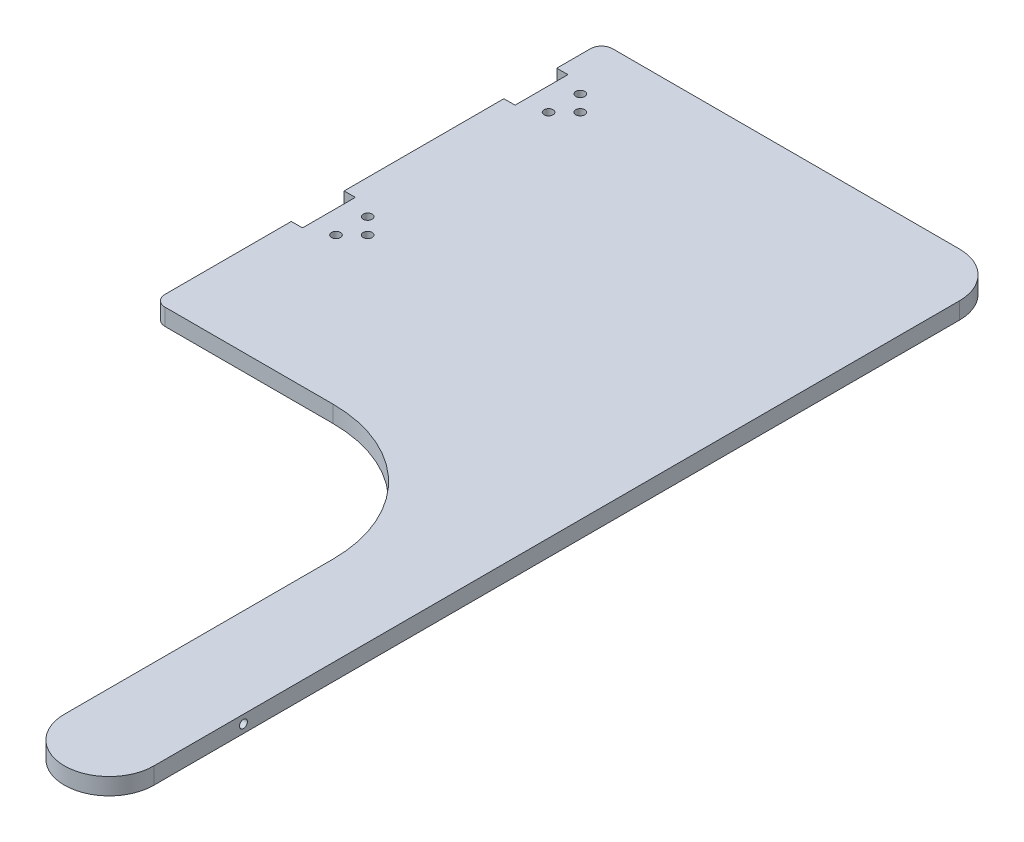
from build123d import *

# Parameters (mm, degrees)
BOSS_EXTRUDE1_DEPTH = 9.525
CUT_EXTRUDE1_REACH  = 343.855
SKETCH2_R           = 2.54
SKETCH2_W           = 6.35
SKETCH2_H           = 30
CUT_EXTRUDE2_REACH  = 343.855
SKETCH3_R           = 2.2479


with BuildPart() as part:
    # Sketch1 → Boss-Extrude1 (new body)
    with BuildSketch(Plane(origin=(0, 0, 0), x_dir=(1, 0, 0), z_dir=(0, 1, 0))):
        with BuildLine():
            Line((6.35, 0), (101.6, 0))
            ThreePointArc((101.6, 0), (155.481536726, -22.318463274), (177.8, -76.2))
            Line((177.8, -76.2), (177.8, -228.6))
            ThreePointArc((177.8, -228.6), (203.2, -254), (228.6, -228.6))
            Line((228.6, -228.6), (228.6, 228.6))
            ThreePointArc((228.6, 228.6), (221.160512242, 246.560512242), (203.2, 254))
            Line((203.2, 254), (6.35, 254))
            ThreePointArc((6.35, 254), (1.859871939, 252.140128061), (0, 247.65))
            Line((0, 247.65), (0, 6.35))
            ThreePointArc((0, 6.35), (1.859871939, 1.859871939), (6.35, 0))
        make_face()
    extrude(amount=BOSS_EXTRUDE1_DEPTH)

    # Sketch2 → Cut-Extrude1 (cut, up to next)
    with BuildSketch(Plane(origin=(0, 9.525, 0), x_dir=(1, 0, 0), z_dir=(0, 1, 0)), mode=Mode.PRIVATE) as cut_extrude1_sk1:
        with Locations((28.34999918, 213.6)):
            Circle(SKETCH2_R)
    cut_extrude1_tool1 = extrude(cut_extrude1_sk1.sketch, amount=-CUT_EXTRUDE1_REACH, mode=Mode.PRIVATE) & part.part
    # Sketch2 → Cut-Extrude1 (cut, up to next)
    with BuildSketch(Plane(origin=(0, 9.525, 0), x_dir=(1, 0, 0), z_dir=(0, 1, 0)), mode=Mode.PRIVATE) as cut_extrude1_sk2:
        with Locations((19.3499994, 222.59999978)):
            Circle(SKETCH2_R)
    cut_extrude1_tool2 = extrude(cut_extrude1_sk2.sketch, amount=-CUT_EXTRUDE1_REACH, mode=Mode.PRIVATE) & part.part
    # Sketch2 → Cut-Extrude1 (cut, up to next)
    with BuildSketch(Plane(origin=(0, 9.525, 0), x_dir=(1, 0, 0), z_dir=(0, 1, 0)), mode=Mode.PRIVATE) as cut_extrude1_sk3:
        with Locations((19.3499994, 204.60000022)):
            Circle(SKETCH2_R)
    cut_extrude1_tool3 = extrude(cut_extrude1_sk3.sketch, amount=-CUT_EXTRUDE1_REACH, mode=Mode.PRIVATE) & part.part
    # Sketch2 → Cut-Extrude1 (cut, up to next)
    with BuildSketch(Plane(origin=(0, 9.525, 0), x_dir=(1, 0, 0), z_dir=(0, 1, 0)), mode=Mode.PRIVATE) as cut_extrude1_sk4:
        with Locations((28.34999918, 92.95)):
            Circle(SKETCH2_R)
    cut_extrude1_tool4 = extrude(cut_extrude1_sk4.sketch, amount=-CUT_EXTRUDE1_REACH, mode=Mode.PRIVATE) & part.part
    # Sketch2 → Cut-Extrude1 (cut, up to next)
    with BuildSketch(Plane(origin=(0, 9.525, 0), x_dir=(1, 0, 0), z_dir=(0, 1, 0)), mode=Mode.PRIVATE) as cut_extrude1_sk5:
        with Locations((19.3499994, 101.94999978)):
            Circle(SKETCH2_R)
    cut_extrude1_tool5 = extrude(cut_extrude1_sk5.sketch, amount=-CUT_EXTRUDE1_REACH, mode=Mode.PRIVATE) & part.part
    # Sketch2 → Cut-Extrude1 (cut, up to next)
    with BuildSketch(Plane(origin=(0, 9.525, 0), x_dir=(1, 0, 0), z_dir=(0, 1, 0)), mode=Mode.PRIVATE) as cut_extrude1_sk6:
        with Locations((19.3499994, 83.95000022)):
            Circle(SKETCH2_R)
    cut_extrude1_tool6 = extrude(cut_extrude1_sk6.sketch, amount=-CUT_EXTRUDE1_REACH, mode=Mode.PRIVATE) & part.part
    # Sketch2 → Cut-Extrude1 (cut, up to next)
    with BuildSketch(Plane(origin=(0, 9.525, 0), x_dir=(1, 0, 0), z_dir=(0, 1, 0)), mode=Mode.PRIVATE) as cut_extrude1_sk7:
        with Locations((3.175, 213.6)):
            Rectangle(SKETCH2_W, SKETCH2_H)
    cut_extrude1_tool7 = extrude(cut_extrude1_sk7.sketch, amount=-CUT_EXTRUDE1_REACH, mode=Mode.PRIVATE) & part.part
    # Sketch2 → Cut-Extrude1 (cut, up to next)
    with BuildSketch(Plane(origin=(0, 9.525, 0), x_dir=(1, 0, 0), z_dir=(0, 1, 0)), mode=Mode.PRIVATE) as cut_extrude1_sk8:
        with Locations((3.175, 92.95)):
            Rectangle(SKETCH2_W, SKETCH2_H)
    cut_extrude1_tool8 = extrude(cut_extrude1_sk8.sketch, amount=-CUT_EXTRUDE1_REACH, mode=Mode.PRIVATE) & part.part
    add(cut_extrude1_tool1.solids().sort_by_distance((28.349999, 9.525, -213.6))[0], mode=Mode.SUBTRACT)
    add(cut_extrude1_tool2.solids().sort_by_distance((19.349999, 9.525, -222.6))[0], mode=Mode.SUBTRACT)
    add(cut_extrude1_tool3.solids().sort_by_distance((19.349999, 9.525, -204.6))[0], mode=Mode.SUBTRACT)
    add(cut_extrude1_tool4.solids().sort_by_distance((28.349999, 9.525, -92.95))[0], mode=Mode.SUBTRACT)
    add(cut_extrude1_tool5.solids().sort_by_distance((19.349999, 9.525, -101.95))[0], mode=Mode.SUBTRACT)
    add(cut_extrude1_tool6.solids().sort_by_distance((19.349999, 9.525, -83.95))[0], mode=Mode.SUBTRACT)
    add(cut_extrude1_tool7.solids().sort_by_distance((3.175, 9.525, -213.6))[0], mode=Mode.SUBTRACT)
    add(cut_extrude1_tool8.solids().sort_by_distance((3.175, 9.525, -92.95))[0], mode=Mode.SUBTRACT)

    # Sketch3 → Cut-Extrude2 (cut, up to next)
    with BuildSketch(Plane(origin=(228.6, 0, 0), x_dir=(0, 0, -1), z_dir=(1, 0, 0)), mode=Mode.PRIVATE) as cut_extrude2_sk1:
        with Locations((-177.8, 4.7625)):
            Circle(SKETCH3_R)
    cut_extrude2_tool1 = extrude(cut_extrude2_sk1.sketch, amount=-CUT_EXTRUDE2_REACH, mode=Mode.PRIVATE) & part.part
    add(cut_extrude2_tool1.solids().sort_by_distance((228.6, 4.7625, 177.8))[0], mode=Mode.SUBTRACT)


solid = part.part
